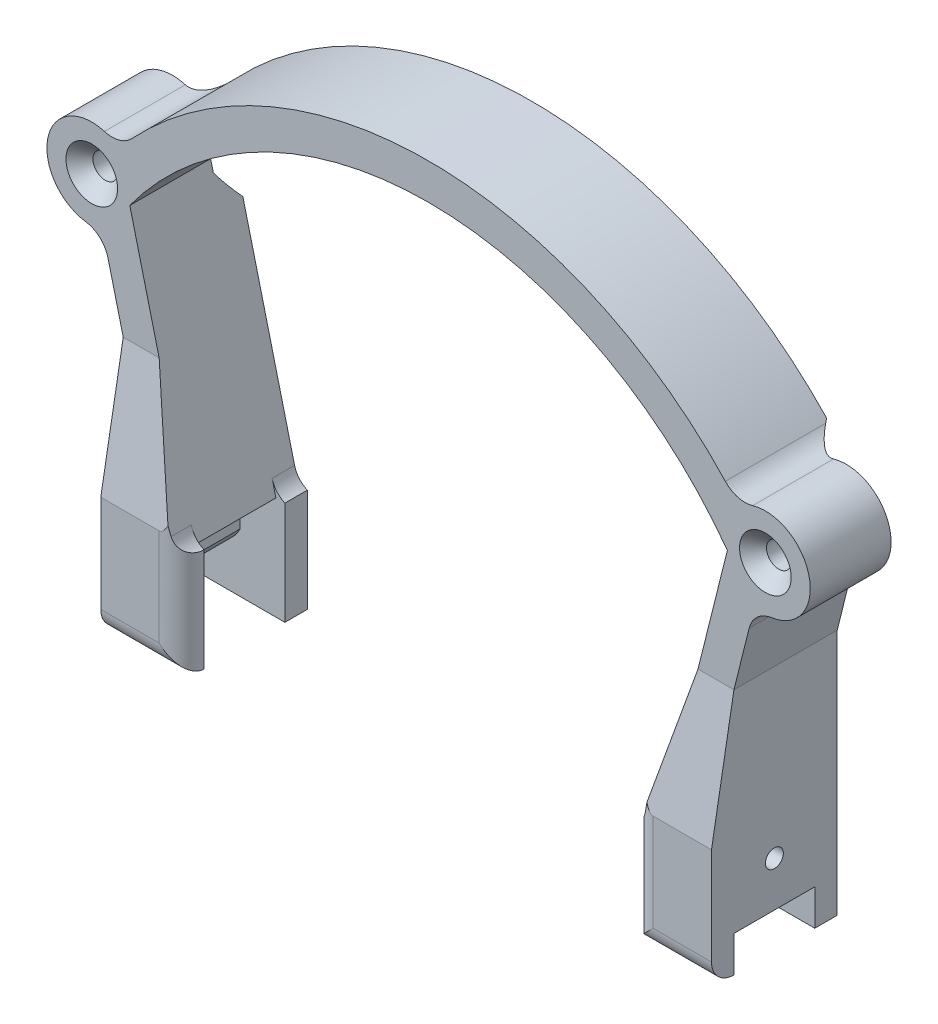
from build123d import *
from OCP.BRepFilletAPI import BRepFilletAPI_MakeChamfer

# Parameters (mm, degrees)
ESQUISSE1_W             = 100
ESQUISSE1_H             = 10
BOSS_EXTRU_1_DEPTH      = 8
ESQUISSE2_W             = 100
ESQUISSE2_H             = 47.5
BOSS_EXTRU_2_DEPTH      = 10
BOSS_EXTRU_3_START      = -18
ESQUISSE3_R             = 2.75
BOSS_EXTRU_3_DEPTH      = 18
CONG_1_R                = 6
ESQUISSE5_W             = 100
ESQUISSE5_H             = 47.5
ENL_V_MAT_EXTRU_2_DEPTH = 3
ESQUISSE6_R             = 2.75
ENL_V_MAT_EXTRU_3_DEPTH = 225.162887353
ESQUISSE7_W             = 60
ESQUISSE7_H             = 60
BOSS_EXTRU_4_DEPTH      = 5
CONG_2_R                = 10
CHANFREIN2_SIZE         = 3
ESQUISSE8_R             = 1.5
ENL_V_MAT_EXTRU_4_DEPTH = 224.81688959
BOSS_EXTRUDE1_DEPTH     = 18
BOSS_EXTRUDE2_DEPTH     = 5
SKETCH6_R               = 2
CUT_EXTRUDE3_DEPTH      = 15
CUT_EXTRUDE2_DEPTH      = 18
MIRROR4_COPY_1_DEPTH    = 5
BOSS_EXTRUDE3_START     = 5
BOSS_EXTRUDE3_DEPTH     = 5
CHAMFER1_SIZE           = 28.356409098
CHAMFER1_SIZE_2         = 5
CHAMFER2_SIZE           = 5
FILLET2_R               = 5
FILLET1_R               = 5


# Some blends are built 0.0001 mm under size
with BuildPart() as part:
    # Esquisse1 → Boss.-Extru.1 (new body)
    with BuildSketch(Plane.XY):
        with BuildLine():
            Line((0, 0), (120, 0))
            Line((120, 0), (120, 70))
            Line((120, 70), (135, 130))
            ThreePointArc((135, 130), (60, 170), (-15, 130))
            Line((-15, 130), (0, 70))
            Line((0, 70), (0, 0))
        make_face()
        with Locations((60, 55)):
            Rectangle(ESQUISSE1_W, ESQUISSE1_H, mode=Mode.SUBTRACT)
        with Locations((60, 29.5)):
            Rectangle(ESQUISSE1_W, ESQUISSE1_H, mode=Mode.SUBTRACT)
        with BuildLine():
            Line((8, 70), (-6.536529961, 128.146119843))
            ThreePointArc((-6.536529961, 128.146119843), (60, 162), (126.536529961, 128.146119843))
            Line((126.536529961, 128.146119843), (112, 70))
            Line((112, 70), (8, 70))
        make_face(mode=Mode.SUBTRACT)
    extrude(amount=BOSS_EXTRU_1_DEPTH)

    # Esquisse2 → Boss.-Extru.2 (add)
    with BuildSketch(Plane.XY.offset(8)):
        with BuildLine():
            Line((0, 70), (0, 0))
            Line((0, 0), (120, 0))
            Line((120, 0), (120, 70))
            Line((120, 70), (135, 130))
            ThreePointArc((135, 130), (60, 170), (-15, 130))
            Line((-15, 130), (0, 70))
        make_face()
        with Locations((60, 42.25)):
            Rectangle(ESQUISSE2_W, ESQUISSE2_H, mode=Mode.SUBTRACT)
        with BuildLine():
            Line((112, 70), (126.536529961, 128.146119843))
            ThreePointArc((126.536529961, 128.146119843), (60, 162), (-6.536529961, 128.146119843))
            Line((-6.536529961, 128.146119843), (8, 70))
            Line((8, 70), (112, 70))
        make_face(mode=Mode.SUBTRACT)
    extrude(amount=BOSS_EXTRU_2_DEPTH)

    # Esquisse3 → Boss.-Extru.3 (add)
    # profile 1 of 2: a face of its own
    with BuildSketch(Plane.XY.offset(18).offset(BOSS_EXTRU_3_START)):
        with BuildLine():
            Line((0, 47), (0, 54))
            Line((0, 54), (-13, 54))
            Line((-13, 54), (-13, -12))
            ThreePointArc((-13, -12), (-3, -22), (7, -12))
            Line((7, -12), (7, 0))
            Line((7, 0), (0, 0))
            Line((0, 0), (0, 7))
            Line((0, 7), (-6, 7))
            Line((-6, 7), (-6, 47))
            Line((-6, 47), (0, 47))
        make_face()
        with Locations((-3, -12)):
            Circle(ESQUISSE3_R, mode=Mode.SUBTRACT)
    # profile 2 of 2: a face of its own
    with BuildSketch(Plane.XY.offset(18).offset(BOSS_EXTRU_3_START)):
        with BuildLine():
            Line((-5.941176471, 125.764705882), (-6.536529961, 128.146119843))
            ThreePointArc((-6.536529961, 128.146119843), (-5.777042038, 129.172127886), (-5.001734316, 130.18623456))
            ThreePointArc((-5.001734316, 130.18623456), (-24.781648189, 132.078306694), (-5.941176471, 125.764705882))
        make_face()
    boss_extru_3 = extrude(amount=BOSS_EXTRU_3_DEPTH)

    # Symétrie1: Boss.-Extru.3 across plane
    add(boss_extru_3.mirror(Plane.ZY.offset(-60)))

    # Congé1
    cong_1_edges = [part.edges().sort_by_distance(p)[0] for p in [
        (7, 0, 9),
        (0, 54, 9),
        (-13, 54, 9),
        (-8.977845414, 137.983336029, 9),
        (-12.57464375, 120.298574999, 9),
        (133, 54, 9),
        (113, 0, 9),
        (120, 54, 9),
        (132.57464375, 120.298574999, 9),
        (128.977845414, 137.983336029, 9),
    ]]
    fillet(cong_1_edges, radius=CONG_1_R)

    # Esquisse5 → Enlèv. mat.-Extru.2 (cut)
    with BuildSketch(Plane.XY.offset(8)):
        with Locations((60, 42.25)):
            Rectangle(ESQUISSE5_W, ESQUISSE5_H)
    extrude(amount=-ENL_V_MAT_EXTRU_2_DEPTH, mode=Mode.SUBTRACT)

    # Esquisse6 → Enlèv. mat.-Extru.3 (cut, through all)
    with BuildSketch(Plane.XY.offset(18)):
        with Locations((-15, 130)):
            Circle(ESQUISSE6_R)
        with Locations((135, 130)):
            Circle(ESQUISSE6_R)
    extrude(amount=-ENL_V_MAT_EXTRU_3_DEPTH, mode=Mode.SUBTRACT)

    # Esquisse7 → Boss.-Extru.4 (add)
    with BuildSketch(Plane(origin=(0, 0, 0), x_dir=(-1, 0, 0), z_dir=(0, 0, -1))):
        with Locations((-60, -30)):
            Rectangle(ESQUISSE7_W, ESQUISSE7_H)
    extrude(amount=-BOSS_EXTRU_4_DEPTH)

    # Congé2
    cong_2_edges = [part.edges().sort_by_distance(p)[0] for p in [
        (60, 0, 5),
        (90, 0, 2.5),
        (30, 0, 2.5),
    ]]
    fillet(cong_2_edges, radius=CONG_2_R)

    # Chanfrein2
    chanfrein2_edges = [part.edges().sort_by_distance(p)[0] for p in [
        (-5.75, -12, 18),
        (125.75, -12, 18),
        (-17.75, 130, 18),
        (132.25, 130, 18),
    ]]
    chamfer(chanfrein2_edges, length=CHANFREIN2_SIZE)

    # Esquisse8 → Enlèv. mat.-Extru.4 (cut, through all)
    with BuildSketch(Plane.XY.offset(5)):
        with Locations((40, -43.333333333)):
            Circle(ESQUISSE8_R)
        with Locations((40, -26.666666667)):
            Circle(ESQUISSE8_R)
        with Locations((60, -26.666666667)):
            Circle(ESQUISSE8_R)
        with Locations((60, -43.333333333)):
            Circle(ESQUISSE8_R)
        with Locations((80, -26.666666667)):
            Circle(ESQUISSE8_R)
        with Locations((80, -43.333333333)):
            Circle(ESQUISSE8_R)
    extrude(amount=-ENL_V_MAT_EXTRU_4_DEPTH, mode=Mode.SUBTRACT)

    # Sketch2 → Boss-Extrude1 (add)
    with BuildSketch(Plane.XY.offset(18)):
        with BuildLine():
            Line((-8, 60), (-8, 102))
            Line((-8, 102), (0, 70))
            Line((0, 70), (0, 60))
            ThreePointArc((0, 60), (-3.283009434, 56.352815094), (-8, 55))
            Line((-8, 55), (-8, 60))
        make_face()
    boss_extrude1 = extrude(amount=-BOSS_EXTRUDE1_DEPTH)

    # Sketch3 → Boss-Extrude2 (add)
    with BuildSketch(Plane(origin=(0, 0, 0), x_dir=(-1, 0, 0), z_dir=(0, 0, -1))):
        Polygon((8, 102), (8, 47), (-10, 47), (-10, 70), (-8, 70), (0, 102), align=None)
    boss_extrude2 = extrude(amount=BOSS_EXTRUDE2_DEPTH)

    # Sketch6 → Cut-Extrude3 (cut)
    with BuildSketch(Plane.ZY.offset(8)):
        with Locations(Location((9, 65, 0), (0, 0, 270))):
            Circle(SKETCH6_R)
    cut_extrude3 = extrude(amount=-CUT_EXTRUDE3_DEPTH, mode=Mode.SUBTRACT)

    # Mirror1: Boss-Extrude1, Cut-Extrude3 across plane
    add(boss_extrude1.mirror(Plane.ZY.offset(-60)))
    add(cut_extrude3.mirror(Plane.ZY.offset(-60)), mode=Mode.SUBTRACT)

    # Mirror3: Boss-Extrude2 across plane
    add(boss_extrude2.mirror(Plane.ZY.offset(-60)))

    # Sketch4 → Cut-Extrude2 (cut)
    with BuildSketch(Plane.XY.offset(18)):
        with BuildLine():
            Line((120, 70), (0, 70))
            Line((0, 70), (0, 60))
            ThreePointArc((0, 60), (-1.757359313, 55.757359313), (-6, 54))
            Line((-6, 54), (-7, 54))
            ThreePointArc((-7, 54), (-11.242640687, 52.242640687), (-13, 48))
            Line((-13, 48), (-13, -60))
            Line((-13, -60), (133, -60))
            Line((133, -60), (133, 48))
            ThreePointArc((133, 48), (131.242640687, 52.242640687), (127, 54))
            Line((127, 54), (126, 54))
            ThreePointArc((126, 54), (121.757359313, 55.757359313), (120, 60))
            Line((120, 60), (120, 70))
        make_face()
    extrude(amount=-CUT_EXTRUDE2_DEPTH, mode=Mode.SUBTRACT)

    # Mirror4: Boss-Extrude2 across plane
    add(boss_extrude2.mirror(Plane.XY.offset(9)))

    # Mirror4 copy 1 sketch → Mirror4 copy 1 (add)
    with BuildSketch(Plane(origin=(120, 0, 18), x_dir=(1, 0, 0), z_dir=(0, 0, 1))):
        Polygon((8, 102), (8, 47), (-10, 47), (-10, 70), (-8, 70), (0, 102), align=None)
    extrude(amount=MIRROR4_COPY_1_DEPTH)

    # Sketch5 → Boss-Extrude3 (add)
    with BuildSketch(Plane(origin=(0, 0, 0), x_dir=(-1, 0, 0), z_dir=(0, 0, -1)).offset(BOSS_EXTRUDE3_START)):
        with BuildLine():
            Line((-131.402615329, 115.610461316), (-128, 102))
            Line((-128, 102), (-120, 102))
            Line((-120, 102), (-125.941176471, 125.764705882))
            ThreePointArc((-125.941176471, 125.764705882), (-130.2319164, 121.209927259), (-136.389668956, 120.097029729))
            ThreePointArc((-136.389668956, 120.097029729), (-133.210561548, 118.615803933), (-131.402615329, 115.610461316))
        make_face()
        with BuildLine():
            ThreePointArc((-126.075357318, 141.25368237), (-128.884007473, 139.55597192), (-132.165711776, 139.589932756))
            ThreePointArc((-132.165711776, 139.589932756), (-127.045379023, 136.060033425), (-125.001734316, 130.18623456))
            ThreePointArc((-125.001734316, 130.18623456), (-60, 162), (5.001734316, 130.18623456))
            ThreePointArc((5.001734316, 130.18623456), (7.045379023, 136.060033425), (12.165711776, 139.589932756))
            ThreePointArc((12.165711776, 139.589932756), (8.884007473, 139.55597192), (6.075357318, 141.25368237))
            ThreePointArc((6.075357318, 141.25368237), (-60, 170), (-126.075357318, 141.25368237))
        make_face()
        with BuildLine():
            ThreePointArc((16.389668956, 120.097029729), (10.2319164, 121.209927259), (5.941176471, 125.764705882))
            Line((5.941176471, 125.764705882), (0, 102))
            Line((0, 102), (8, 102))
            Line((8, 102), (11.402615329, 115.610461316))
            ThreePointArc((11.402615329, 115.610461316), (13.210561548, 118.615803933), (16.389668956, 120.097029729))
        make_face()
    extrude(amount=-BOSS_EXTRUDE3_DEPTH)

    # Chamfer1
    chamfer1_edges_1 = [part.edges().sort_by_distance(p)[0] for p in [
        (124, 102, 23),
    ]]
    chamfer1_side_1 = [part.faces().sort_by_distance(p)[0] for p in [
        (124, 101.9, 23),
    ]]
    chamfer1_edges_2 = [part.edges().sort_by_distance(p)[0] for p in [
        (-4, 102, 23),
    ]]
    chamfer1_side_2 = [part.faces().sort_by_distance(p)[0] for p in [
        (-4, 102, 22.9),
    ]]
    chamfer1 = BRepFilletAPI_MakeChamfer(part.part.solid().wrapped)
    for e in chamfer1_edges_1:
        chamfer1.Add(CHAMFER1_SIZE - 0.0001, CHAMFER1_SIZE_2 - 0.0001, e.wrapped, chamfer1_side_1[0].wrapped)
    for e in chamfer1_edges_2:
        chamfer1.Add(CHAMFER1_SIZE_2 - 0.0001, CHAMFER1_SIZE - 0.0001, e.wrapped, chamfer1_side_2[0].wrapped)
    add(Compound.cast(chamfer1.Shape()), mode=Mode.REPLACE)  # a hair under: the kernel refuses the full size

    # Chamfer2
    chamfer2_edges = [part.edges().sort_by_distance(p)[0] for p in [
        (130.2319164, 121.209927259, -5),
        (-7.045379023, 136.060033425, -5),
        (127.045379023, 136.060033425, -5),
        (-10.2319164, 121.209927259, -5),
    ]]
    chamfer(chamfer2_edges, length=CHAMFER2_SIZE - 0.0001)  # a hair under: the kernel refuses the full size

    # Fillet2
    # the kernel refuses this fillet: 5 mm, written as the material it adds along each edge
    with BuildSketch(Plane(origin=(8, 70, -5), x_dir=(-0.2425356250363325, 0.970142500145332, 0), z_dir=(0, 0, 1)), Plane(origin=(8, 70, 18), x_dir=(-0.2425356250363325, 0.970142500145332, 0), z_dir=(0, 0, 1))) as fillet2_piece_1:
        with BuildLine():
            CenterArc((3.46943809, -5), FILLET2_R, 90, 52.269872505)
            Line((-0.48507125, -1.940285), (0, 0))
            Line((0, 0), (3.46943809, 0))
        make_face()
    extrude(amount=5)
    with BuildSketch(Plane(origin=(112, 70, -5), x_dir=(0.2425356250363291, 0.9701425001453328, 0), z_dir=(0, 0, 1)), Plane(origin=(112, 70, 18), x_dir=(0.2425356250363291, 0.9701425001453328, 0), z_dir=(0, 0, 1))) as fillet2_piece_2:
        with BuildLine():
            CenterArc((3.46943809, 5), FILLET2_R, 217.730127495, 52.269872505)
            Line((-0.48507125, 1.940285), (0, 0))
            Line((0, 0), (3.46943809, 0))
        make_face()
    extrude(amount=5)

    # Fillet1
    fillet1_edges = [part.edges().sort_by_distance(p)[0] for p in [
        (110, 58.5, 23),
        (10, 58.5, 23),
        (1, 47, 23),
        (119, 47, 23),
    ]]
    fillet(fillet1_edges, radius=FILLET1_R - 0.0001)  # a hair under: the kernel refuses the full size


solid = part.part
